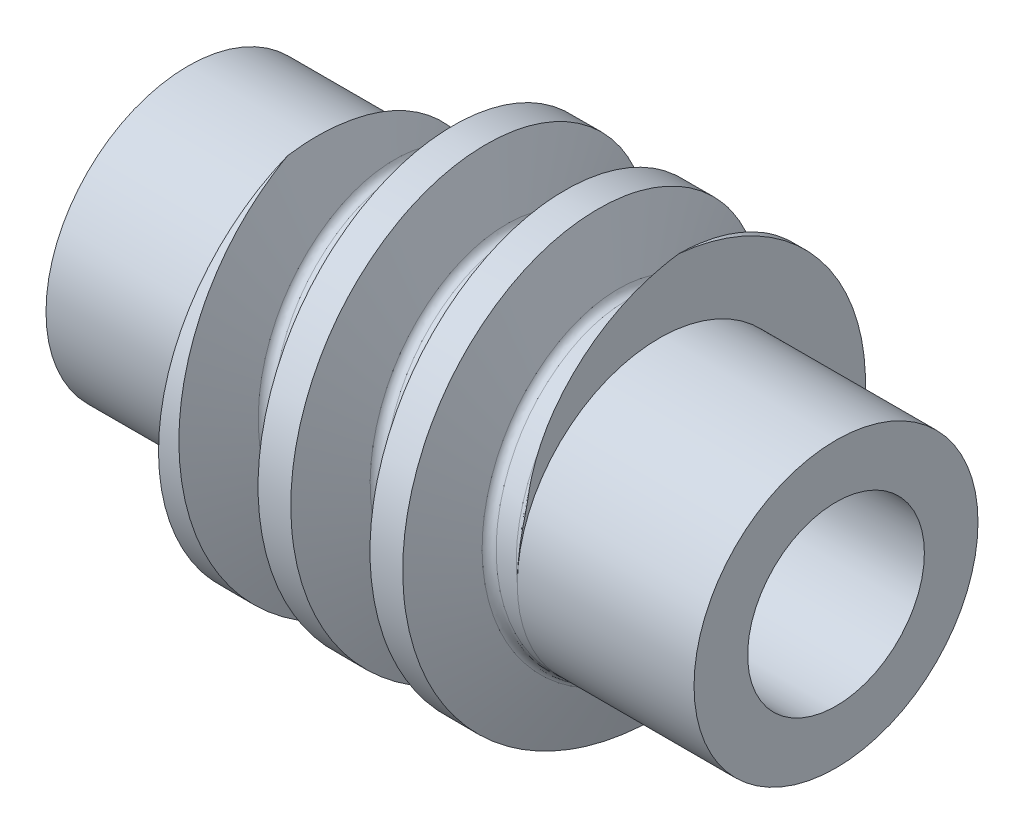
from build123d import *

# Parameters (mm, degrees)
SKETCH_1_W                = 5
SKETCH_1_H                = 3.5
SWEEP_1_PITCH             = 1.9
SKETCH_4_R                = 2.41
EXTRUDE_1_DEPTH           = 3
EXTRUDE_START             = 3
SKETCH_5_R                = 2.41
EXTRUDE_2_DEPTH           = 3
HOLE_WIZARD_3_0_3_1_D     = 3
HOLE_WIZARD_3_0_3_1_DEPTH = 30.32
HOLE_WIZARD_3_0_3_1_TIP   = 0.901290929


with BuildPart() as part:
    # 草图1 → 旋转1 (revolve)
    with BuildSketch(Plane.XY, mode=Mode.PRIVATE) as revolve_1_sk:
        with Locations((2.5, 1.75)):
            Rectangle(SKETCH_1_W, SKETCH_1_H)
    revolve(revolve_1_sk.sketch.rotate(Axis((-56.849408284, 0, 0), (1, 0, 0)), 90), axis=Axis((-56.849408284, 0, 0), (1, 0, 0)))

    # 切除-扫描1: the profile of 草图3 profile screwed along a right-hand helix of 9 turns, 10 arcs to a turn; built about Z, then put on its axis
    sweep_1_z = Axis((0, 0, 0), (0, 0, 1))
    sweep_1_corners = [(3.5003, 0, -2.016064542), (3.5003, 0, -0.671875926), (2.508696979, 0, -1.03278991), (2.41, 0, -1.173743803), (2.41, 0, -1.514196665), (2.508696979, 0, -1.655150558)]
    with BuildLine(mode=Mode.PRIVATE) as sweep_1_profile:
        Line(sweep_1_corners[0], sweep_1_corners[1])
        Line(sweep_1_corners[1], sweep_1_corners[2])
        Line(sweep_1_corners[3], sweep_1_corners[4])
        Line(sweep_1_corners[5], sweep_1_corners[0])
        ThreePointArc((2.508696979, 0, -1.03278991), (2.437127193, 0, -1.087707338), (2.41, 0, -1.173743803))
        ThreePointArc((2.41, 0, -1.514196665), (2.437127193, 0, -1.600233131), (2.508696979, 0, -1.655150558))
    sweep_1_cap = Face(sweep_1_profile.wire())
    sweep_1_arcs = [((2.508696979, 0, -1.03278991), (2.41, 0, -1.068712672), (2.41, 0, -1.173743803), (1, 0.819152044288986, 1)), ((2.41, 0, -1.514196665), (2.41, 0, -1.619227796), (2.508696979, 0, -1.655150558), (1, 0.8191520442889935, 1))]  # start, shoulder, end, weights
    sweep_1_turn_angles = [0, 18, 36, 54, 72, 90, 108, 126, 144, 162, 180, 198, 216, 234, 252, 270, 288, 306, 324, 342, 360]
    sweep_1_turn_weights = [1, 0.9510565162951535, 1, 0.9510565162951535, 1, 0.9510565162951535, 1, 0.9510565162951535, 1, 0.9510565162951535, 1, 0.9510565162951535, 1, 0.9510565162951535, 1, 0.9510565162951535, 1, 0.9510565162951535, 1, 0.9510565162951535, 1]
    sweep_1_turn_rails = [Edge.make_bspline([Vector(p[0], p[1], 0).rotate(sweep_1_z, sweep_1_turn_angles[k]) / sweep_1_turn_weights[k] + Vector(0, 0, p[2] + SWEEP_1_PITCH * sweep_1_turn_angles[k] / 360) for k in range(21)], [0, 0, 0, 1, 1, 2, 2, 3, 3, 4, 4, 5, 5, 6, 6, 7, 7, 8, 8, 9, 9, 10, 10, 10], 2, sweep_1_turn_weights) for p in sweep_1_corners]
    sweep_1_turn_sides = [*[Face.make_surface_from_curves(sweep_1_turn_rails[p[0]], sweep_1_turn_rails[p[1]]) for p in [(0, 1), (1, 2), (3, 4), (5, 0)]], *[Face.make_bezier_surface([[Vector(p[j][0], p[j][1], 0).rotate(sweep_1_z, sweep_1_turn_angles[2 * i + k]) / sweep_1_turn_weights[2 * i + k] + Vector(0, 0, p[j][2] + SWEEP_1_PITCH * sweep_1_turn_angles[2 * i + k] / 360) for k in range(3)] for j in range(3)], [[p[3][j] * sweep_1_turn_weights[2 * i + k] for k in range(3)] for j in range(3)]) for p in sweep_1_arcs for i in range(10)]]
    sweep_1 = Plane(origin=(0, 0, 0), x_dir=(0, 1, 0), z_dir=(1, 0, 0)) * Solid(Shell([*[p.moved(Location((0, 0, SWEEP_1_PITCH * i))) for i in range(9) for p in sweep_1_turn_sides], sweep_1_cap, sweep_1_cap.rotate(sweep_1_z, 3240).moved(Location((0, 0, SWEEP_1_PITCH * 3240 / 360)))]))
    add(sweep_1, mode=Mode.SUBTRACT)

    # 草图4 → 凸台-拉伸1 (add)
    with BuildSketch(Plane(origin=(0, 0, 0), x_dir=(0, 0, -1), z_dir=(1, 0, 0))):
        Circle(SKETCH_4_R)
    extrude(amount=-EXTRUDE_1_DEPTH)

    # 草图5 → 凸台-拉伸2 (add)
    with BuildSketch(Plane(origin=(5, 0, 0), x_dir=(0, 0, -1), z_dir=(1, 0, 0)).offset(EXTRUDE_START)):
        Circle(SKETCH_5_R)
    extrude(amount=-EXTRUDE_2_DEPTH)

    # Ø3.0 (3) 直径孔1
    with Locations(Plane(origin=(8, 0, 0), x_dir=(0, 0, -1), z_dir=(1, 0, 0))):
        with Locations((0, 0)):
            Hole(HOLE_WIZARD_3_0_3_1_D / 2, depth=HOLE_WIZARD_3_0_3_1_DEPTH)
            with Locations((0, 0, -(HOLE_WIZARD_3_0_3_1_DEPTH + HOLE_WIZARD_3_0_3_1_TIP / 2))):  # 118° drill point
                Cone(0, HOLE_WIZARD_3_0_3_1_D / 2, HOLE_WIZARD_3_0_3_1_TIP, mode=Mode.SUBTRACT)


solid = part.part
